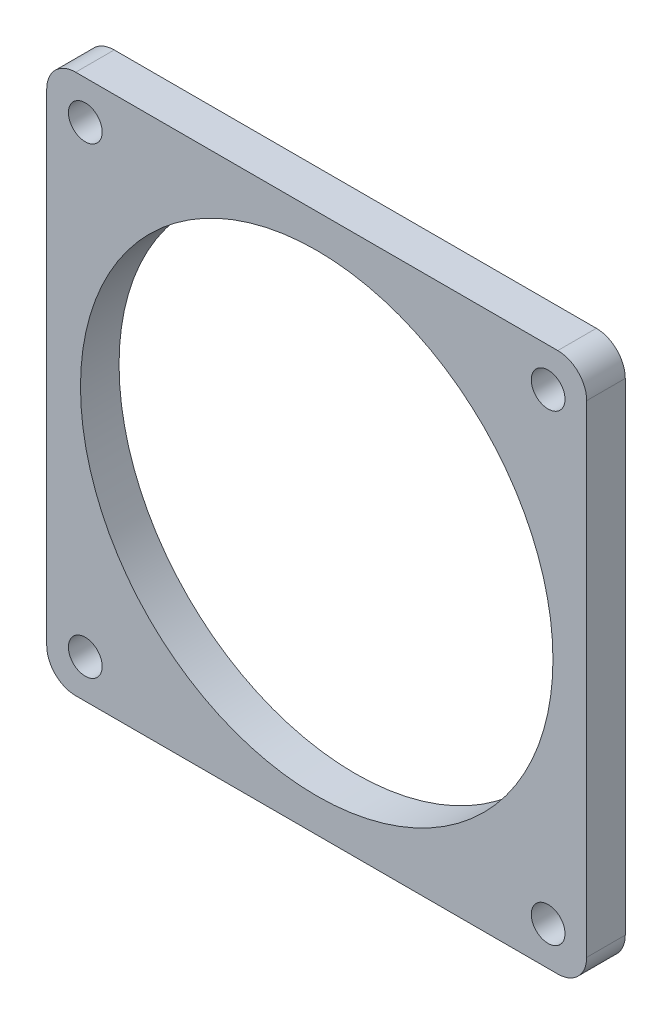
from build123d import *

# Parameters (mm, degrees)
SKETCH_1_W             = 56
SKETCH_1_H             = 56
SM_BASE_FLANGE_1_DEPTH = 4
SKETCH_6_R             = 24.5
SKETCH_6_R_2           = 1.75
CUT_EXTRUDE_1_DEPTH    = 4
FILLET_1_R             = 3


# Sheet-metal steps are written as plain solids
with BuildPart() as part:
    # Sketch 1 → Базовая кромка1 (new body)
    with BuildSketch(Plane.XY):
        Rectangle(SKETCH_1_W, SKETCH_1_H)
    extrude(amount=-SM_BASE_FLANGE_1_DEPTH)

    # Эскиз6 → Вырез-Вытянуть1 (cut)
    with BuildSketch(Plane.XY):
        Circle(SKETCH_6_R)
        with Locations((-24, 24)):
            Circle(SKETCH_6_R_2)
        with Locations((24, 24)):
            Circle(SKETCH_6_R_2)
        with Locations((24, -24)):
            Circle(SKETCH_6_R_2)
        with Locations((-24, -24)):
            Circle(SKETCH_6_R_2)
    extrude(amount=-CUT_EXTRUDE_1_DEPTH, mode=Mode.SUBTRACT)

    # Скругление1
    fillet_1_edges = [part.edges().sort_by_distance(p)[0] for p in [
        (28, -28, -2),
        (-28, -28, -2),
        (-28, 28, -2),
        (28, 28, -2),
    ]]
    fillet(fillet_1_edges, radius=FILLET_1_R)


solid = part.part
